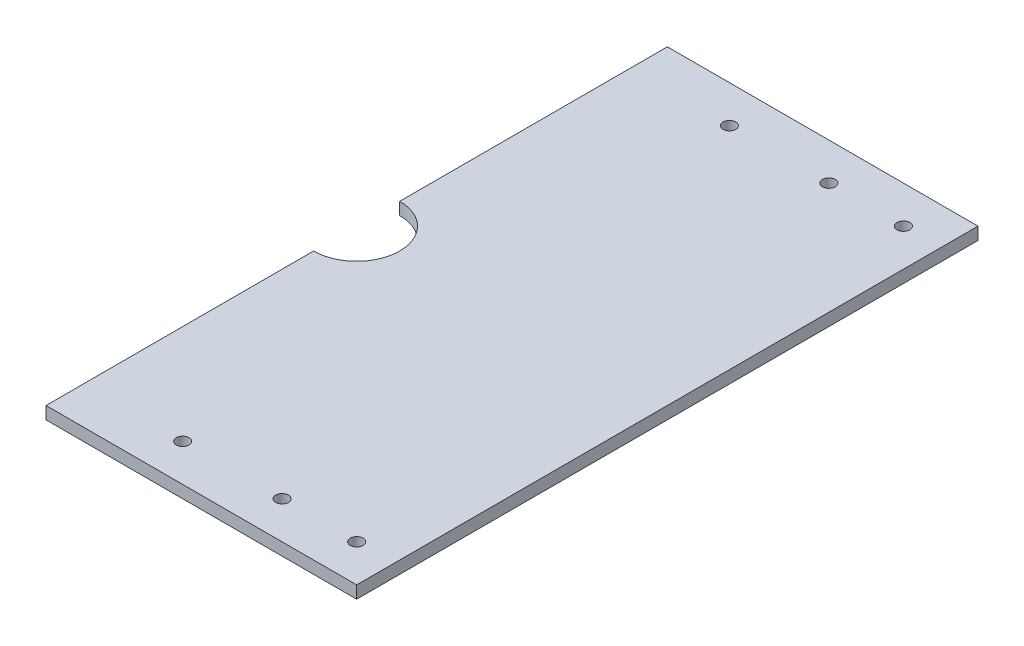
from build123d import *

# Parameters (mm, degrees)
SKETCH1_R           = 1.63195
BOSS_EXTRUDE1_DEPTH = 3.175


with BuildPart() as part:
    # Sketch1 → Boss-Extrude1 (new body)
    with BuildSketch(Plane(origin=(0, 0, 0), x_dir=(1, 0, 0), z_dir=(0, 1, 0))):
        with BuildLine():
            Line((0, -11), (0, -79.375))
            Line((0, -79.375), (79.37, -79.375))
            Line((79.37, -79.375), (79.37, 79.375))
            Line((79.37, 79.375), (0, 79.375))
            Line((0, 79.375), (0, 11))
            ThreePointArc((0, 11), (11, 0), (0, -11))
        make_face()
        with Locations((69.84, 69.845)):
            Circle(SKETCH1_R, mode=Mode.SUBTRACT)
        with Locations((69.84, -69.845)):
            Circle(SKETCH1_R, mode=Mode.SUBTRACT)
        with Locations((50.79, 69.845)):
            Circle(SKETCH1_R, mode=Mode.SUBTRACT)
        with Locations((25.39, 69.845)):
            Circle(SKETCH1_R, mode=Mode.SUBTRACT)
        with Locations((50.79, -69.845)):
            Circle(SKETCH1_R, mode=Mode.SUBTRACT)
        with Locations((25.39, -69.845)):
            Circle(SKETCH1_R, mode=Mode.SUBTRACT)
    extrude(amount=BOSS_EXTRUDE1_DEPTH)


solid = part.part
